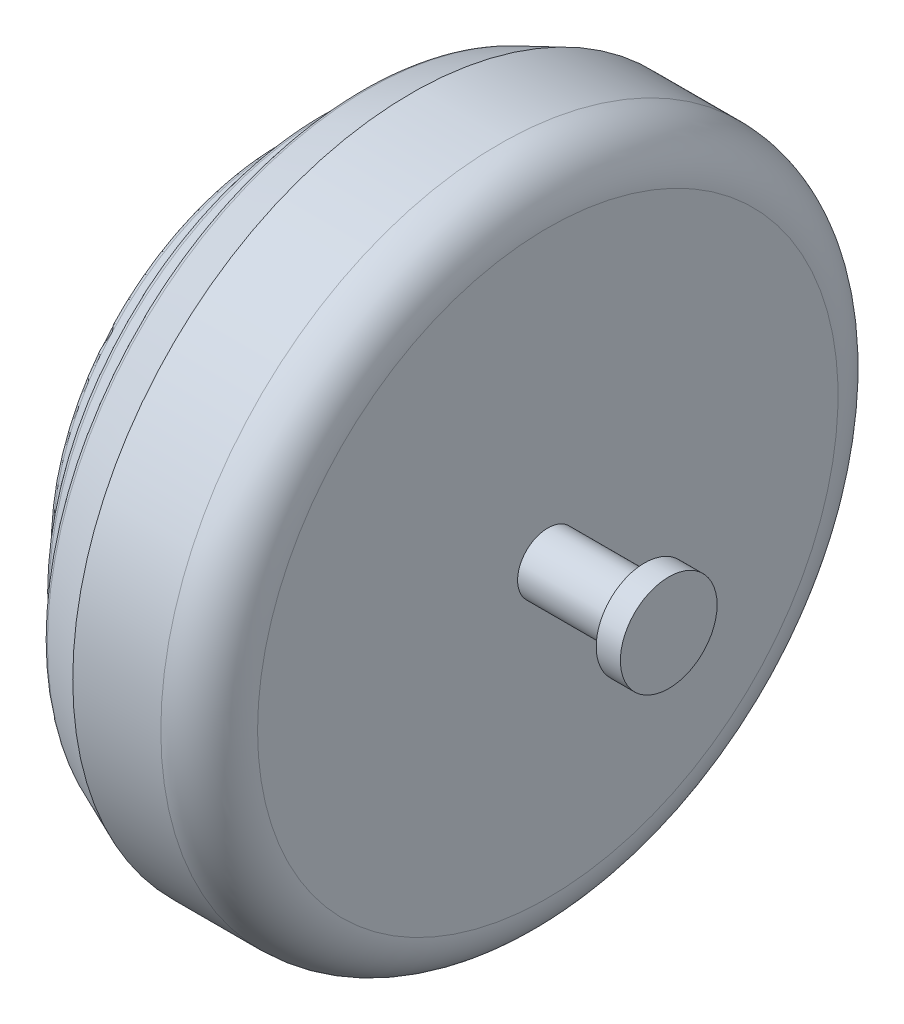
from build123d import *

# Parameters (mm, degrees)
REDONDEO3_R             = 5
CROQUIS2_R              = 12.5
SALIENTE_EXTRUIR1_DEPTH = 40
CROQUIS3_R              = 20
SALIENTE_EXTRUIR2_DEPTH = 10


with BuildPart() as part:
    # Croquis1 → Revolución1 (revolve)
    with BuildSketch(Plane(origin=(0, 0, 0), x_dir=(1, 0, 0), z_dir=(0, 1, 0))):
        with BuildLine():
            Line((106.445710743, 140), (70.03994637, 140))
            Line((70.03994637, 140), (48.737618848, 130.932753785))
            Line((48.737618848, 130.932753785), (48.737618848, 120.610275725))
            Line((48.737618848, 120.610275725), (31.868809424, 113.430137863))
            Line((31.868809424, 113.430137863), (31.868809424, 102.180137863))
            Line((31.868809424, 102.180137863), (15, 95))
            Line((15, 95), (15, 0))
            Line((15, 0), (70, 0))
            Line((70, 0), (126.445710743, 0))
            Line((126.445710743, 0), (126.445710743, 120))
            ThreePointArc((126.445710743, 120), (120.587846367, 134.142135624), (106.445710743, 140))
        make_face()
    revolve(axis=Axis((-209.218950064, 0, 0), (1, 0, 0)))

    # Redondeo3
    redondeo3_edges = [part.edges().sort_by_distance(p)[0] for p in [
        (15, 0, 95),
        (31.868809424, 0, 102.180137863),
        (31.868809424, 0, 113.430137863),
        (48.737618848, 0, 120.610275725),
        (48.737618848, 0, 130.932753785),
    ]]
    fillet(redondeo3_edges, radius=REDONDEO3_R)

    # Croquis2 → Saliente-Extruir1 (add)
    with BuildSketch(Plane(origin=(126.445710743, 0, 0), x_dir=(0, 0, -1), z_dir=(1, 0, 0))):
        Circle(CROQUIS2_R)
    extrude(amount=SALIENTE_EXTRUIR1_DEPTH)

    # Croquis3 → Saliente-Extruir2 (add)
    with BuildSketch(Plane(origin=(166.445710743, 0, 0), x_dir=(0, 0, -1), z_dir=(1, 0, 0))):
        Circle(CROQUIS3_R)
    extrude(amount=SALIENTE_EXTRUIR2_DEPTH)


solid = part.part
